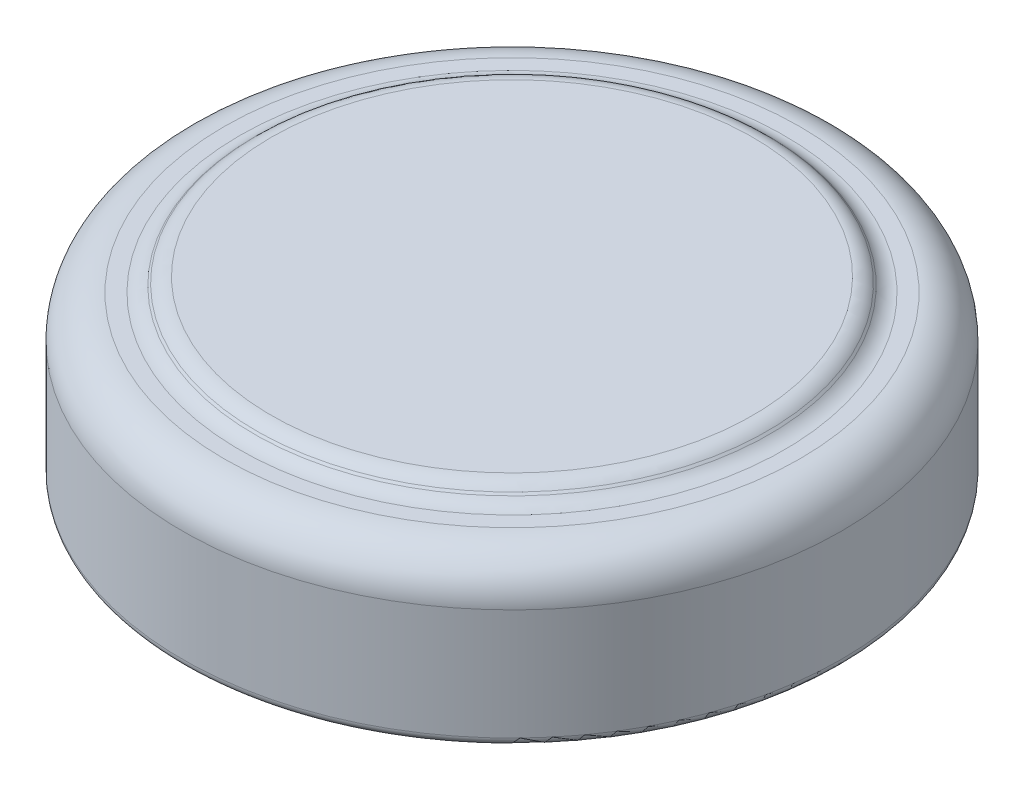
from build123d import *


with BuildPart() as part:
    # Sketch1 → Revolve1 (revolve)
    with BuildSketch(Plane.XY):
        with BuildLine():
            Line((0, 0), (-3.85, 0))
            ThreePointArc((-3.85, 0), (-3.920710678, 0.029289322), (-3.95, 0.1))
            Line((-3.95, 0.1), (-3.95, 1.43))
            ThreePointArc((-3.95, 1.43), (-3.803553391, 1.783553391), (-3.45, 1.93))
            Line((-3.45, 1.93), (-3.263553391, 1.93))
            ThreePointArc((-3.263553391, 1.93), (-3.167882533, 1.949030117), (-3.086776695, 2.003223305))
            Line((-3.086776695, 2.003223305), (-3.063223305, 2.026776695))
            ThreePointArc((-3.063223305, 2.026776695), (-2.982117467, 2.080969883), (-2.886446609, 2.1))
            Line((-2.886446609, 2.1), (0, 2.1))
            Line((0, 2.1), (0, 0))
        make_face()
    revolve(axis=Axis((0, 2.1, 0), (0, -1, 0)))


solid = part.part
